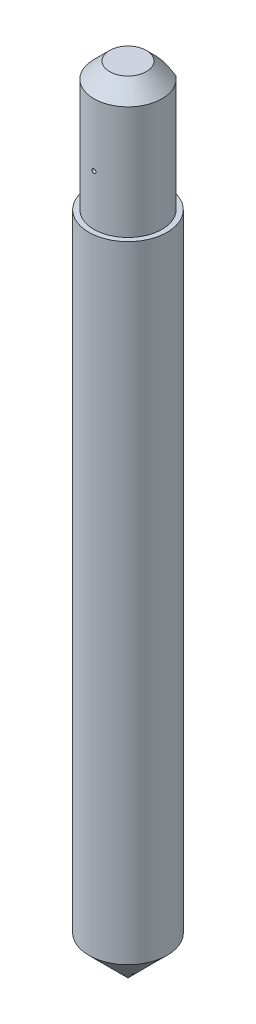
from build123d import *

# Parameters (mm, degrees)
SKETCH1_R           = 5
BOSS_EXTRUDE1_DEPTH = 85
CHAMFER1_SIZE       = 5
BOSS_EXTRUDE2_DEPTH = 16.45


with BuildPart() as part:
    # Sketch1 → Boss-Extrude1 (new body)
    with BuildSketch(Plane(origin=(0, 0, 0), x_dir=(1, 0, 0), z_dir=(0, 1, 0))):
        with Locations(Location((0, 0, 0), (0, 0, 270))):
            Circle(SKETCH1_R)
    extrude(amount=BOSS_EXTRUDE1_DEPTH)

    # Chamfer1
    chamfer1_edges = [part.edges().sort_by_distance(p)[0] for p in [
        (0, 0, -5),
    ]]
    chamfer(chamfer1_edges, length=CHAMFER1_SIZE)

    # Sketch2 → Boss-Extrude2 (add)
    with BuildSketch(Plane(origin=(0, 85, 0), x_dir=(1, 0, 0), z_dir=(0, 1, 0))):
        with BuildLine():
            Line((-2.64952826, 3.45), (2.64952826, 3.45))
            ThreePointArc((2.64952826, 3.45), (0, -4.35), (-2.64952826, 3.45))
        make_face()
    extrude(amount=BOSS_EXTRUDE2_DEPTH)

    # Chamfer2: read off the stored shape, not the designer's step
    # Chamfer2 outline → Chamfer2 (revolve, cut)
    with BuildSketch(Plane.XY):
        Polygon((4.35, 101.45), (2.35, 101.45), (4.35, 99.45), align=None)
    revolve(axis=Axis((0, 0, 0), (0, 1, 0)), mode=Mode.SUBTRACT)

    # Sketch3 → Cut-Revolve1 (revolve, cut)
    with BuildSketch(Plane(origin=(0, 0, 0), x_dir=(0, 0, -1), z_dir=(1, 0, 0))):
        with BuildLine():
            Line((-4.35, 91.2), (-4.35, 91.7))
            ThreePointArc((-4.35, 91.7), (-4.1, 91.45), (-4.35, 91.2))
        make_face()
    revolve(axis=Axis((0, 91.2, 4.35), (0, 1, 0)), mode=Mode.SUBTRACT)


solid = part.part
